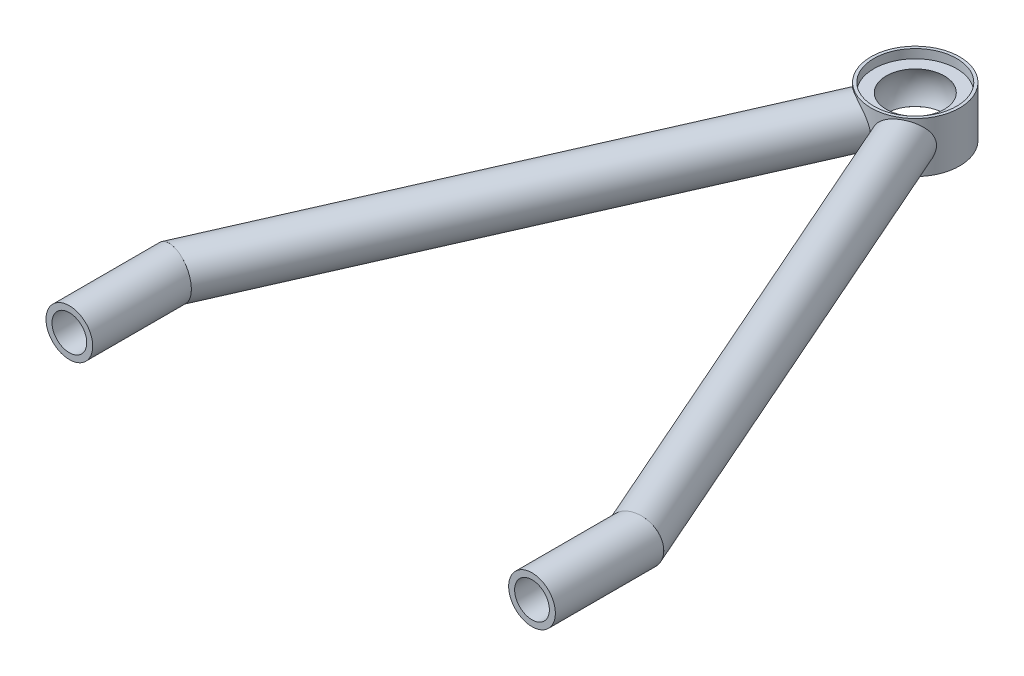
from build123d import *

# Parameters (mm, degrees)
SKETCH1_ON_SEGMENT_1_R                  = 7.9
SKETCH1_ON_SEGMENT_1_R_2                = 5.875
CIRCULAR_TUBE_21_3_X_2_3_1_DEPTH        = 38.350868903
CIRCULAR_TUBE_21_3_X_2_3_1_2_DEPTH      = 178.412650039
CIRCULAR_TUBE_21_3_X_2_3_1_2_DEPTH_BACK = 3.350868903
SKETCH1_R                               = 7.9
SKETCH1_R_2                             = 5.875
SKETCH11_ON_SEGMENT_1_R                 = 7.9
SKETCH11_ON_SEGMENT_1_R_2               = 5.875
CIRCULAR_TUBE_21_3_X_2_3_2_DEPTH        = 38.350868903
CIRCULAR_TUBE_21_3_X_2_3_2_2_DEPTH      = 178.412650039
CIRCULAR_TUBE_21_3_X_2_3_2_2_DEPTH_BACK = 3.350868903
SKETCH11_R                              = 7.9
SKETCH11_R_2                            = 5.875
SKETCH_1_R                              = 15
EXTRUDE_1_DEPTH                         = 8.5
SKETCH_5_R                              = 14
CUT_EXTRUDE_1_DEPTH                     = 3
SKETCH_7_R                              = 14
CUT_EXTRUDE_2_DEPTH                     = 3
WELD_START                              = -9
WELD_TRIM_4_DEPTH                       = 18
WELD_TRIM_4_2_DEPTH                     = 18


with BuildPart() as part:
    # Sketch1 on segment 1 (carried to segment 1) → Circular tube 21.3 X 2.3(1) (new body)
    with BuildSketch(Plane(origin=(-78.21449332, 0, 195.502886979), x_dir=(-1, 0, 0), z_dir=(0, 0, -1))):
        Circle(SKETCH1_ON_SEGMENT_1_R)
        Circle(SKETCH1_ON_SEGMENT_1_R_2, mode=Mode.SUBTRACT)
    extrude(amount=CIRCULAR_TUBE_21_3_X_2_3_1_DEPTH)

    # Circular tube 21.3 X 2.3(1) mitre 1
    split(bisect_by=Plane(origin=(-78.21449332, 0, 160.502886979), x_dir=(0, -1, 0), z_dir=(-0.205910543, 0, 0.978570819)), keep=Keep.TOP)


with BuildPart() as body_2:
    # Sketch1 → Circular tube 21.3 X 2.3_1 2 (new, two sides: drawn at the far end of the back side and taken through both)
    with BuildSketch(Plane(origin=(-78.21449332, 0, 160.502886979), x_dir=(-0.9152016968098962, 0, -0.4029960969491974), z_dir=(0.4029960969491974, 0, -0.9152016968098962)).offset(-CIRCULAR_TUBE_21_3_X_2_3_1_2_DEPTH_BACK)):
        Circle(SKETCH1_R)
        Circle(SKETCH1_R_2, mode=Mode.SUBTRACT)
    extrude(amount=CIRCULAR_TUBE_21_3_X_2_3_1_2_DEPTH + CIRCULAR_TUBE_21_3_X_2_3_1_2_DEPTH_BACK)

    # Circular tube 21.3 X 2.3_1 2 mitre 1
    split(bisect_by=Plane(origin=(-78.21449332, 0, 160.502886979), x_dir=(0, 1, 0), z_dir=(0.205910543, 0, -0.978570819)), keep=Keep.TOP)


with BuildPart() as body_3:
    # Sketch11 on segment 1 (carried to segment 1) → Circular tube 21.3 X 2.3(2) (new body)
    with BuildSketch(Plane(origin=(78.21449332, 0, 195.502886979), x_dir=(-1, 0, 0), z_dir=(0, 0, -1))):
        Circle(SKETCH11_ON_SEGMENT_1_R)
        Circle(SKETCH11_ON_SEGMENT_1_R_2, mode=Mode.SUBTRACT)
    extrude(amount=CIRCULAR_TUBE_21_3_X_2_3_2_DEPTH)

    # Circular tube 21.3 X 2.3(2) mitre 1
    split(bisect_by=Plane(origin=(78.21449332, 0, 160.502886979), x_dir=(0, -1, 0), z_dir=(0.205910543, 0, 0.978570819)), keep=Keep.TOP)


with BuildPart() as body_4:
    # Sketch11 → Circular tube 21.3 X 2.3_2 2 (new, two sides: drawn at the far end of the back side and taken through both)
    with BuildSketch(Plane(origin=(78.21449332, 0, 160.502886979), x_dir=(-0.9152016968098962, 0, 0.40299609694919775), z_dir=(-0.40299609694919775, 0, -0.9152016968098962)).offset(-CIRCULAR_TUBE_21_3_X_2_3_2_2_DEPTH_BACK)):
        Circle(SKETCH11_R)
        Circle(SKETCH11_R_2, mode=Mode.SUBTRACT)
    extrude(amount=CIRCULAR_TUBE_21_3_X_2_3_2_2_DEPTH + CIRCULAR_TUBE_21_3_X_2_3_2_2_DEPTH_BACK)

    # Circular tube 21.3 X 2.3_2 2 mitre 1
    split(bisect_by=Plane(origin=(78.21449332, 0, 160.502886979), x_dir=(0, 1, 0), z_dir=(-0.205910543, 0, -0.978570819)), keep=Keep.TOP)


with BuildPart() as body_5:
    # 스케치1 → 보스-돌출1 (new, symmetric)
    with BuildSketch(Plane(origin=(0, 0, 0), x_dir=(1, 0, 0), z_dir=(0, 1, 0))):
        with Locations(Location((0, 12.307113021, 0), (0, 0, 270))):
            Circle(SKETCH_1_R)
    extrude(amount=EXTRUDE_1_DEPTH, both=True)


with BuildPart() as cut_extrude_1_tool:
    # 스케치5 → 컷-돌출1 (new body)
    with BuildSketch(Plane(origin=(0, 8.5, 0), x_dir=(1, 0, 0), z_dir=(0, 1, 0))):
        with Locations(Location((0, 12.307113021, 0), (0, 0, 270))):
            Circle(SKETCH_5_R)
    extrude(amount=-CUT_EXTRUDE_1_DEPTH)


with BuildPart() as body_2_1:
    add(body_2.part)

    # 컷-돌출1: cut by cut_extrude_1_tool
    add(cut_extrude_1_tool.part, mode=Mode.SUBTRACT)


with BuildPart() as body_4_1:
    add(body_4.part)

    # 컷-돌출1: cut by cut_extrude_1_tool
    add(cut_extrude_1_tool.part, mode=Mode.SUBTRACT)


with BuildPart() as body_5_1:
    add(body_5.part)

    # 컷-돌출1: cut by cut_extrude_1_tool
    add(cut_extrude_1_tool.part, mode=Mode.SUBTRACT)


with BuildPart() as cut_extrude_2_tool:
    # 스케치7 → 컷-돌출2 (new body)
    with BuildSketch(Plane.XZ.offset(8.5)):
        with Locations(Location((0, -12.307113021, 0), (0, 0, 90))):
            Circle(SKETCH_7_R)
    extrude(amount=-CUT_EXTRUDE_2_DEPTH)


with BuildPart() as body_2_2:
    add(body_2_1.part)

    # 컷-돌출2: cut by cut_extrude_2_tool
    add(cut_extrude_2_tool.part, mode=Mode.SUBTRACT)

    # Weld Trim 4 2 outline → Weld Trim 4 2 (cut)
    with BuildSketch(Plane(origin=(0, 0, 0), x_dir=(1, 0, 0), z_dir=(0, 1, 0)).offset(WELD_START)):
        with BuildLine():
            ThreePointArc((-13.56855558, 5.912247934), (-8.072813552, -0.335263392), (-0.092992229, -2.692598725))
            Line((-0.092992229, -2.692598725), (2, -2.705574442))
            Line((2, -2.705574442), (2, -0.880671656))
            Line((2, -0.880671656), (0.915201697, -0.402996097))
            Line((0.915201697, -0.402996097), (-4.424689992, 1.948349531))
            Line((-4.424689992, 1.948349531), (-8.205093424, 3.612996606))
            Line((-8.205093424, 3.612996606), (-13.544985113, 5.964342235))
            Line((-13.544985113, 5.964342235), (-13.60570988, 5.991081524))
            Line((-13.60570988, 5.991081524), (-13.56855558, 5.912247934))
        make_face()
    extrude(amount=WELD_TRIM_4_2_DEPTH, mode=Mode.SUBTRACT)


with BuildPart() as body_4_2:
    add(body_4_1.part)

    # 컷-돌출2: cut by cut_extrude_2_tool
    add(cut_extrude_2_tool.part, mode=Mode.SUBTRACT)

    # Weld Trim 4: read off the stored shape, not the designer's step
    # Weld Trim 4 outline → Weld Trim 4 (cut)
    with BuildSketch(Plane(origin=(0, 0, 0), x_dir=(1, 0, 0), z_dir=(0, 1, 0)).offset(WELD_START)):
        with BuildLine():
            ThreePointArc((0.092364574, -2.692602603), (8.072226744, -0.33563808), (13.568229514, 5.911556137))
            Line((13.568229514, 5.911556137), (13.605716105, 5.991084266))
            Line((13.605716105, 5.991084266), (13.544985113, 5.964342235))
            Line((13.544985113, 5.964342235), (8.205093424, 3.612996607))
            Line((8.205093424, 3.612996607), (4.424689992, 1.948349532))
            Line((4.424689992, 1.948349532), (-0.915201697, -0.402996097))
            Line((-0.915201697, -0.402996097), (-2, -0.880671655))
            Line((-2, -0.880671655), (-2, -2.705486871))
            Line((-2, -2.705486871), (0.092364574, -2.692602603))
        make_face()
    extrude(amount=WELD_TRIM_4_DEPTH, mode=Mode.SUBTRACT)


with BuildPart() as body_5_2:
    add(body_5_1.part)

    # 컷-돌출2: cut by cut_extrude_2_tool
    add(cut_extrude_2_tool.part, mode=Mode.SUBTRACT)

    # 스케치9 → 컷-회전1 (revolve, cut)
    with BuildSketch(Plane(origin=(0, 0, 0), x_dir=(0, 0, -1), z_dir=(1, 0, 0))):
        with BuildLine():
            Line((12.307113021, -11.25), (12.307113021, 11.25))
            ThreePointArc((12.307113021, 11.25), (23.557113021, 0), (12.307113021, -11.25))
        make_face()
    revolve(axis=Axis((0, 8.5, -12.307113021), (0, -1, 0)), mode=Mode.SUBTRACT)


solid = Compound([part.part, body_3.part, body_2_2.part, body_4_2.part, body_5_2.part])
